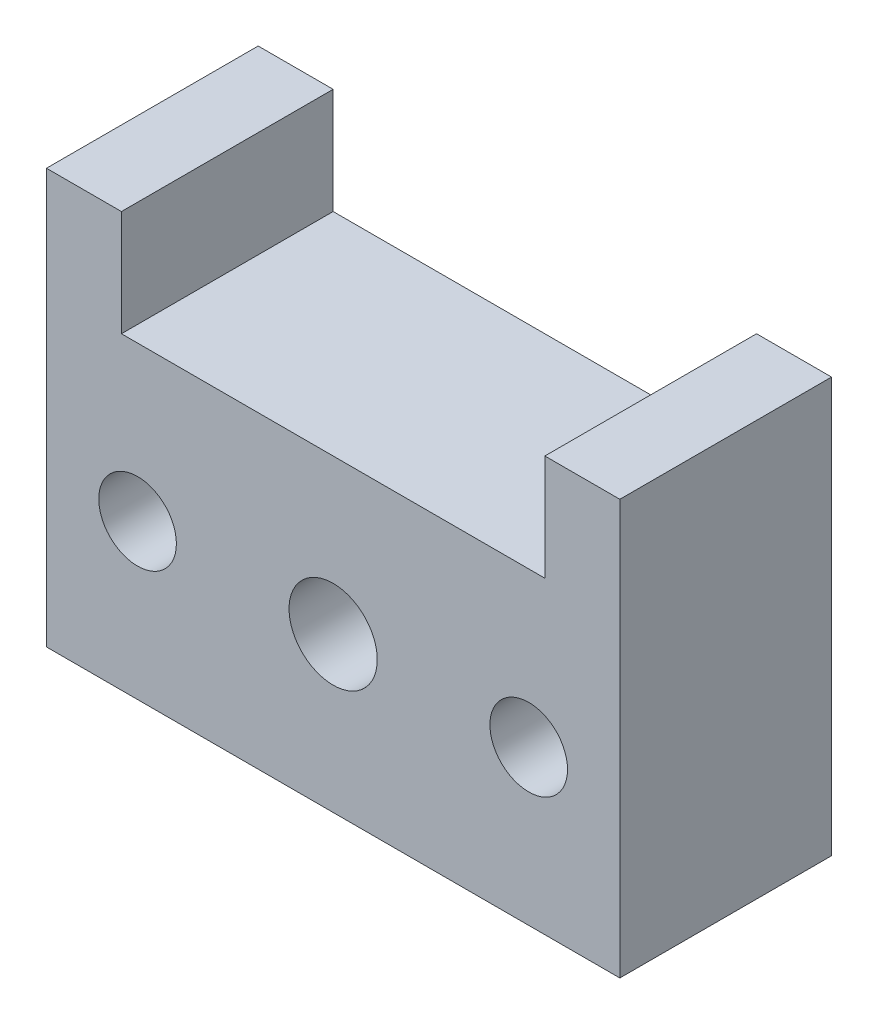
from build123d import *

# Parameters (mm, degrees)
SKETCH1_R           = 4.4
SKETCH1_R_2         = 5
BOSS_EXTRUDE1_DEPTH = 24


with BuildPart() as part:
    # Sketch1 → Boss-Extrude1 (new body)
    with BuildSketch(Plane.XY):
        Polygon((-32.5, 29.5), (-32.5, -17.5), (32.5, -17.5), (32.5, 29.5), (24, 29.5), (24, 17.5), (-24, 17.5), (-24, 29.5), align=None)
        with Locations((22.171280209, 0)):
            Circle(SKETCH1_R, mode=Mode.SUBTRACT)
        with Locations((-22.171280209, 0)):
            Circle(SKETCH1_R, mode=Mode.SUBTRACT)
        Circle(SKETCH1_R_2, mode=Mode.SUBTRACT)
    extrude(amount=BOSS_EXTRUDE1_DEPTH)


solid = part.part
